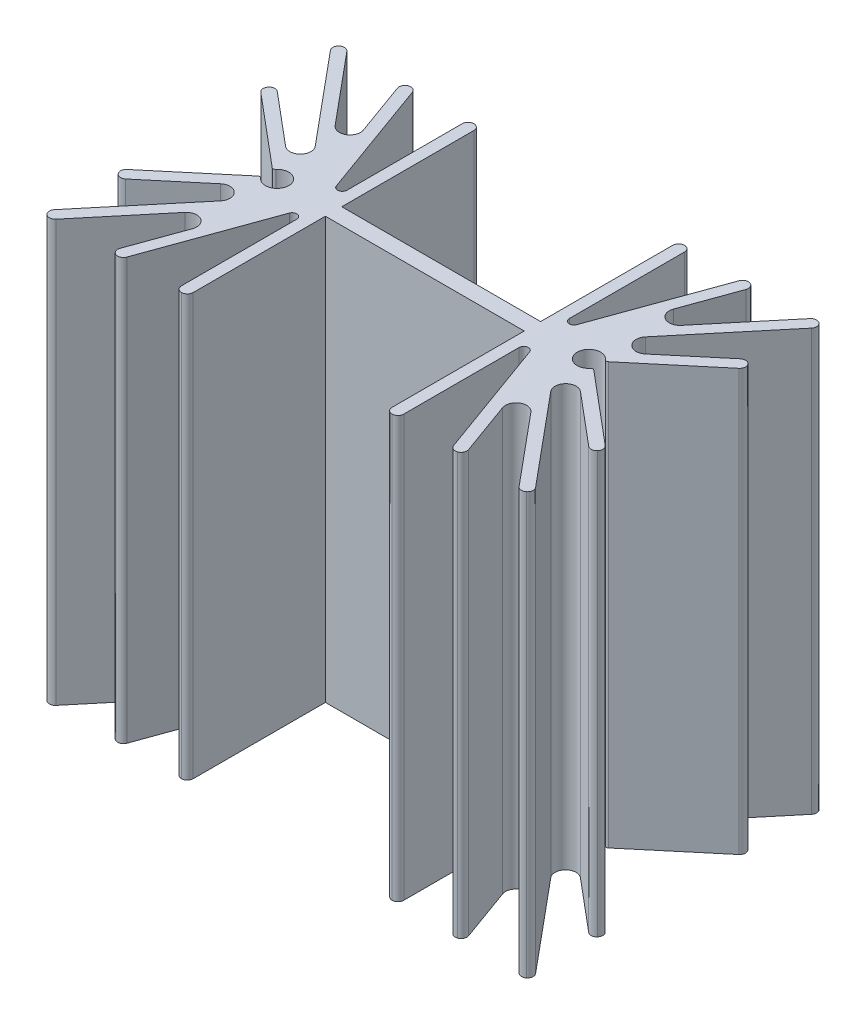
from build123d import *

# Parameters (mm, degrees)
INNER_HALF_DEPTH          = 18
FLANGES_REACH             = 25.885
FLANGES_DIRECTION_2_REACH = 25.885
FILLET1_R                 = 0.5
FILLET1_OF_MIRROR1_R      = 0.5
MIRROR3_START             = -18
MIRROR3_DEPTH             = 36
SKETCH3_R                 = 1
INNER_CIRCLE_DEPTH        = 44.391544118
M3_5X0_6_TAPPED_HOLE1_D   = 2.9
FILLET3_R                 = 0.2
FILLET2_R                 = 0.5


# Read off the part's stored shape, not the designer's step: Mirror3
with BuildPart() as part:
    # Sketch1 → INNER HALF (new, symmetric)
    with BuildSketch(Plane(origin=(0, 0, 0), x_dir=(1, 0, 0), z_dir=(0, 1, 0))):
        Polygon((-8.5, 0.7), (0, 0.7), (0, -0.7), (-8.5, -0.7), (-8.5, -12.5), (-9.5, -12.5), (-9.5, 12.5), (-8.5, 12.5), align=None)
    inner_half = extrude(amount=INNER_HALF_DEPTH, both=True)

    # Mirror2: INNER HALF across plane
    add(inner_half.mirror(Plane(origin=(0, 0, 0), x_dir=(0, 0, 1), z_dir=(1, 0, 0))))

    # FLANGES: up to this face of the body (flat: up to its plane)
    flanges_end = Plane(part.part.faces().sort_by_distance((0, 18, 0))[0])
    # Sketch2 → FLANGES (add, up to the picked face)
    with BuildSketch(Plane(origin=(0, 0, 0), x_dir=(1, 0, 0), z_dir=(0, 1, 0)), mode=Mode.PRIVATE) as flanges_sk1:
        with BuildLine():
            Line((-10.276164759, 2.012372382), (-14.129794052, 12.670018723))
            Line((-14.129794052, 12.670018723), (-15.070205948, 12.329981277))
            Line((-15.070205948, 12.329981277), (-13.253629293, 7.306033701))
            ThreePointArc((-13.253629293, 7.306033701), (-13.652352407, 6.219223699), (-14.791703546, 6.42419951))
            Line((-14.791703546, 6.42419951), (-20.115720252, 12.819889161))
            Line((-20.115720252, 12.819889161), (-20.884279748, 12.180110839))
            Line((-20.884279748, 12.180110839), (-14.108296454, 4.040187803))
            ThreePointArc((-14.108296454, 4.040187803), (-14.164853061, 2.826744492), (-15.378508849, 2.774947314))
            Line((-15.378508849, 2.774947314), (-20.178606195, 6.802707227))
            Line((-20.178606195, 6.802707227), (-20.821393805, 6.036662784))
            Line((-20.821393805, 6.036662784), (-13.627179245, 0))
            Line((-13.627179245, 0), (-9.5, 0))
            Line((-9.5, 0), (-9.5, 2.14838736))
            ThreePointArc((-9.5, 2.14838736), (-9.830956186, 1.754391228), (-10.276164759, 2.012372382))
        make_face()
    flanges_tool1 = split(extrude(flanges_sk1.sketch, amount=FLANGES_REACH, mode=Mode.PRIVATE), bisect_by=flanges_end, keep=Keep.BOTH, mode=Mode.PRIVATE)
    flanges = flanges_tool1.solids().sort_by(Axis((-14.387215, 0, -5.095322), (0, 1, 0)))[0]
    add(flanges)

    # FLANGES direction 2: up to this face of the body (flat: up to its plane)
    flanges_direction_2_end = Plane(part.part.faces().sort_by_distance((0, -18, 0))[0])
    # Sketch2 → FLANGES direction 2 (add, up to the picked face)
    with BuildSketch(Plane(origin=(0, 0, 0), x_dir=(1, 0, 0), z_dir=(0, 1, 0)), mode=Mode.PRIVATE) as flanges_direction_2_sk1:
        with BuildLine():
            Line((-10.276164759, 2.012372382), (-14.129794052, 12.670018723))
            Line((-14.129794052, 12.670018723), (-15.070205948, 12.329981277))
            Line((-15.070205948, 12.329981277), (-13.253629293, 7.306033701))
            ThreePointArc((-13.253629293, 7.306033701), (-13.652352407, 6.219223699), (-14.791703546, 6.42419951))
            Line((-14.791703546, 6.42419951), (-20.115720252, 12.819889161))
            Line((-20.115720252, 12.819889161), (-20.884279748, 12.180110839))
            Line((-20.884279748, 12.180110839), (-14.108296454, 4.040187803))
            ThreePointArc((-14.108296454, 4.040187803), (-14.164853061, 2.826744492), (-15.378508849, 2.774947314))
            Line((-15.378508849, 2.774947314), (-20.178606195, 6.802707227))
            Line((-20.178606195, 6.802707227), (-20.821393805, 6.036662784))
            Line((-20.821393805, 6.036662784), (-13.627179245, 0))
            Line((-13.627179245, 0), (-9.5, 0))
            Line((-9.5, 0), (-9.5, 2.14838736))
            ThreePointArc((-9.5, 2.14838736), (-9.830956186, 1.754391228), (-10.276164759, 2.012372382))
        make_face()
    flanges_direction_2_tool1 = split(extrude(flanges_direction_2_sk1.sketch, amount=-FLANGES_DIRECTION_2_REACH, mode=Mode.PRIVATE), bisect_by=flanges_direction_2_end, keep=Keep.BOTH, mode=Mode.PRIVATE)
    flanges_direction_2 = flanges_direction_2_tool1.solids().sort_by(Axis((-14.387215, 0, -5.095322), (0, -1, 0)))[0]
    add(flanges_direction_2)

    # Fillet1
    fillet1_edges = [part.edges().sort_by_distance(p)[0] for p in [
        (-20.821393805, 0, -6.036662784),
        (-20.178606195, 0, -6.802707227),
        (-20.115720252, 0, -12.819889161),
        (-20.884279748, 0, -12.180110839),
        (-14.129794052, 0, -12.670018723),
        (-15.070205948, 0, -12.329981277),
    ]]
    fillet(fillet1_edges, radius=FILLET1_R - 0.0001)  # a hair under: the kernel refuses the full size

    # Mirror1: FLANGES, FLANGES direction 2 across plane
    add(flanges.mirror(Plane.XY))
    add(flanges_direction_2.mirror(Plane.XY))

    # Fillet1 of Mirror1
    fillet1_of_mirror1_edges = [part.edges().sort_by_distance(p)[0] for p in [
        (-20.821393805, 0, 6.036662784),
        (-20.178606195, 0, 6.802707227),
        (-20.115720252, 0, 12.819889161),
        (-20.884279748, 0, 12.180110839),
        (-14.129794052, 0, 12.670018723),
        (-15.070205948, 0, 12.329981277),
    ]]
    fillet(fillet1_of_mirror1_edges, radius=FILLET1_OF_MIRROR1_R - 0.0001)  # a hair under: the kernel refuses the full size

    # Mirror3 outline → Mirror3 (add)
    with BuildSketch(Plane(origin=(0, 0, 0), x_dir=(1, 0, 0), z_dir=(0, 1, 0)).offset(MIRROR3_START)):
        with BuildLine():
            ThreePointArc((14.6, 12.5), (14.217716854, 12.482501258), (13.959775329, 12.199812774))
            Line((13.959775329, 12.199812774), (10.276164759, 2.012372382))
            ThreePointArc((10.276164759, 2.012372382), (9.830956186, 1.754391228), (9.5, 2.14838736))
            Line((9.5, 2.14838736), (9.5, -2.14838736))
            ThreePointArc((9.5, -2.14838736), (9.830956186, -1.754391228), (10.276164759, -2.012372382))
            Line((10.276164759, -2.012372382), (13.959775329, -12.199812774))
            ThreePointArc((13.959775329, -12.199812774), (14.217716854, -12.482501258), (14.6, -12.5))
            ThreePointArc((14.6, -12.5), (14.882688484, -12.242058475), (14.900187226, -11.859775329))
            Line((14.900187226, -11.859775329), (13.253629293, -7.306033701))
            ThreePointArc((13.253629293, -7.306033701), (13.652352407, -6.219223699), (14.791703546, -6.42419951))
            Line((14.791703546, -6.42419951), (19.795831091, -12.435609413))
            ThreePointArc((19.795831091, -12.435609413), (20.134579818, -12.613642863), (20.5, -12.5))
            ThreePointArc((20.5, -12.5), (20.67803345, -12.161251273), (20.564390587, -11.795831091))
            Line((20.564390587, -11.795831091), (14.108296454, -4.040187803))
            ThreePointArc((14.108296454, -4.040187803), (14.164853061, -2.826744492), (15.378508849, -2.774947314))
            Line((15.378508849, -2.774947314), (19.795583974, -6.481313422))
            ThreePointArc((19.795583974, -6.481313422), (20.16055565, -6.59638855), (20.5, -6.419685006))
            ThreePointArc((20.5, -6.419685006), (20.615075127, -6.054713329), (20.438371583, -5.715268979))
            Line((20.438371583, -5.715268979), (13.627179245, 0))
            Line((13.627179245, 0), (20.438371583, 5.715268979))
            ThreePointArc((20.438371583, 5.715268979), (20.615075127, 6.054713329), (20.5, 6.419685006))
            ThreePointArc((20.5, 6.419685006), (20.16055565, 6.59638855), (19.795583974, 6.481313422))
            Line((19.795583974, 6.481313422), (15.378508849, 2.774947314))
            ThreePointArc((15.378508849, 2.774947314), (14.164853061, 2.826744492), (14.108296454, 4.040187803))
            Line((14.108296454, 4.040187803), (20.564390587, 11.795831091))
            ThreePointArc((20.564390587, 11.795831091), (20.67803345, 12.161251273), (20.5, 12.5))
            ThreePointArc((20.5, 12.5), (20.134579818, 12.613642863), (19.795831091, 12.435609413))
            Line((19.795831091, 12.435609413), (14.791703546, 6.42419951))
            ThreePointArc((14.791703546, 6.42419951), (13.652352407, 6.219223699), (13.253629293, 7.306033701))
            Line((13.253629293, 7.306033701), (14.900187226, 11.859775329))
            ThreePointArc((14.900187226, 11.859775329), (14.882688484, 12.242058475), (14.6, 12.5))
        make_face()
    extrude(amount=MIRROR3_DEPTH)

    # Sketch3 → INNER CIRCLE (cut, symmetric)
    with BuildSketch(Plane(origin=(0, 18, 0), x_dir=(1, 0, 0), z_dir=(0, 1, 0))):
        with Locations((-13.327179245, 0)):
            Circle(SKETCH3_R)
    inner_circle = extrude(amount=INNER_CIRCLE_DEPTH, both=True, mode=Mode.SUBTRACT)

    # Mirror6: INNER CIRCLE across plane
    add(inner_circle.mirror(Plane(origin=(0, 0, 0), x_dir=(0, 0, 1), z_dir=(1, 0, 0))), mode=Mode.SUBTRACT)

    # M3.5x0.6 Tapped Hole1 (through all)
    with Locations(Plane.XY.offset(0.7)):
        with Locations((0, 6)):
            Hole(M3_5X0_6_TAPPED_HOLE1_D / 2)

    # Fillet3
    fillet3_edges = [part.edges().sort_by_distance(p)[0] for p in [
        (-14.202798531, 0, 0.483001931),
        (-14.202798531, 0, -0.483001931),
        (14.202798531, 0, 0.483001931),
        (14.202798531, 0, -0.483001931),
    ]]
    fillet(fillet3_edges, radius=FILLET3_R)

    # Fillet2
    fillet2_edges = [part.edges().sort_by_distance(p)[0] for p in [
        (-8.5, 0, 12.5),
        (-9.5, 0, 12.5),
        (-8.5, 0, -12.5),
        (-9.5, 0, -12.5),
        (9.5, 0, 12.5),
        (8.5, 0, 12.5),
        (9.5, 0, -12.5),
        (8.5, 0, -12.5),
    ]]
    fillet(fillet2_edges, radius=FILLET2_R - 0.0001)  # a hair under: the kernel refuses the full size


solid = part.part
